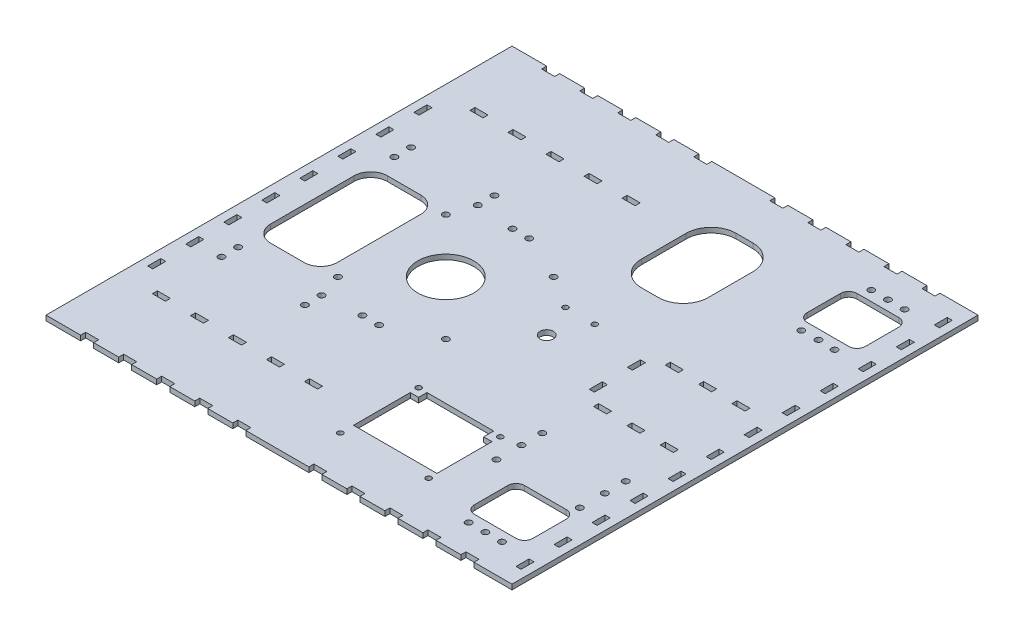
from build123d import *

# Parameters (mm, degrees)
SKETCH1_W               = 279.4
SKETCH1_H               = 279.4
BOSS_EXTRUDE1_DEPTH     = 3
SKETCH3_W               = 3
SKETCH3_H               = 7.8
CUT_EXTRUDE2_DEPTH      = 198.588410591
LPATTERN1_COUNT         = 12
LPATTERN1_PITCH         = 22.8
SKETCH5_W               = 7.8
SKETCH5_H               = 3
CUT_EXTRUDE3_DEPTH      = 198.588410591
LPATTERN2_COUNT         = 11
LPATTERN2_PITCH         = 22.8
MIRROR2_COPY_1_SKETCH_W = 7.8
MIRROR2_COPY_1_SKETCH_H = 3
MIRROR2_COPY_1_DEPTH    = 198.588410591
MIRROR2_COPY_2_SKETCH_W = 7.8
MIRROR2_COPY_2_SKETCH_H = 3
MIRROR2_COPY_2_DEPTH    = 198.588410591
MIRROR2_COPY_3_SKETCH_W = 7.8
MIRROR2_COPY_3_SKETCH_H = 3
MIRROR2_COPY_3_DEPTH    = 198.588410591
MIRROR2_COPY_4_SKETCH_W = 7.8
MIRROR2_COPY_4_SKETCH_H = 3
MIRROR2_COPY_4_DEPTH    = 198.588410591
MIRROR2_COPY_5_SKETCH_W = 7.8
MIRROR2_COPY_5_SKETCH_H = 3
MIRROR2_COPY_5_DEPTH    = 198.588410591
MIRROR2_COPY_6_SKETCH_W = 7.8
MIRROR2_COPY_6_SKETCH_H = 3
MIRROR2_COPY_6_DEPTH    = 198.588410591
MIRROR2_COPY_7_SKETCH_W = 7.8
MIRROR2_COPY_7_SKETCH_H = 3
MIRROR2_COPY_7_DEPTH    = 198.588410591
MIRROR2_COPY_8_SKETCH_W = 7.8
MIRROR2_COPY_8_SKETCH_H = 3
MIRROR2_COPY_8_DEPTH    = 198.588410591
MIRROR2_COPY_9_SKETCH_W = 7.8
MIRROR2_COPY_9_SKETCH_H = 3
MIRROR2_COPY_9_DEPTH    = 198.588410591
SKETCH6_W               = 3
SKETCH6_H               = 7.8
CUT_EXTRUDE4_DEPTH      = 198.588410591
LPATTERN3_COUNT         = 8
LPATTERN3_PITCH         = 22.8
SKETCH7_R               = 16.75
CUT_EXTRUDE5_DEPTH      = 198.588410591
F_6_CLEARANCE_HOLE1_D   = 3.7973
F_6_CLEARANCE_HOLE2_D   = 3.7973
SKETCH14_R              = 4
CUT_EXTRUDE6_DEPTH      = 198.588410591
SKETCH16_W              = 7.8
SKETCH16_H              = 3
CUT_EXTRUDE8_DEPTH      = 198.588410591
LPATTERN5_COUNT         = 5
LPATTERN5_PITCH         = 22.8
MIRROR4_COPY_1_SKETCH_W = 7.8
MIRROR4_COPY_1_SKETCH_H = 3
MIRROR4_COPY_1_DEPTH    = 198.588410591
MIRROR4_COPY_2_SKETCH_W = 7.8
MIRROR4_COPY_2_SKETCH_H = 3
MIRROR4_COPY_2_DEPTH    = 198.588410591
MIRROR4_COPY_3_SKETCH_W = 7.8
MIRROR4_COPY_3_SKETCH_H = 3
MIRROR4_COPY_3_DEPTH    = 198.588410591
MIRROR4_COPY_4_SKETCH_W = 7.8
MIRROR4_COPY_4_SKETCH_H = 3
MIRROR4_COPY_4_DEPTH    = 198.588410591
SKETCH17_W              = 7.8
SKETCH17_H              = 3
CUT_EXTRUDE9_DEPTH      = 198.588410591
LPATTERN6_COUNT         = 3
LPATTERN6_PITCH         = 20
SKETCH18_W              = 3
SKETCH18_H              = 7.8
CUT_EXTRUDE10_DEPTH     = 198.588410591
MIRROR5_COPY_1_SKETCH_W = 7.8
MIRROR5_COPY_1_SKETCH_H = 3
MIRROR5_COPY_1_DEPTH    = 198.588410591
MIRROR5_COPY_2_SKETCH_W = 7.8
MIRROR5_COPY_2_SKETCH_H = 3
MIRROR5_COPY_2_DEPTH    = 198.588410591
CUT_EXTRUDE11_DEPTH     = 198.588410591
F_4_CLEARANCE_HOLE1_D   = 3.2639
CUT_EXTRUDE12_REACH     = 199.588
F_6_CLEARANCE_HOLE3_D   = 3.7973
F_4_CLEARANCE_HOLE2_D   = 3.2639


with BuildPart() as part:
    # Sketch1 → Boss-Extrude1 (new body)
    with BuildSketch(Plane(origin=(0, 0, 0), x_dir=(1, 0, 0), z_dir=(0, 1, 0))):
        Rectangle(SKETCH1_W, SKETCH1_H)
    extrude(amount=BOSS_EXTRUDE1_DEPTH)

    # Sketch3 → Cut-Extrude2 (cut, through all)
    with BuildSketch(Plane(origin=(0, 0, 0), x_dir=(-1, 0, 0), z_dir=(0, -1, 0))):
        with Locations((-133.2, 125.4)):
            Rectangle(SKETCH3_W, SKETCH3_H)
    cut_extrude2 = extrude(amount=-CUT_EXTRUDE2_DEPTH, mode=Mode.SUBTRACT)

    # LPattern1: Cut-Extrude2 ×12
    with Locations(*[(0, 0, i * LPATTERN1_PITCH) for i in range(1, LPATTERN1_COUNT)]):
        add(cut_extrude2, mode=Mode.SUBTRACT)

    # Sketch5 → Cut-Extrude3 (cut, through all)
    with BuildSketch(Plane.XZ):
        with Locations((113, -138.2)):
            Rectangle(SKETCH5_W, SKETCH5_H)
    cut_extrude3 = extrude(amount=-CUT_EXTRUDE3_DEPTH, mode=Mode.SUBTRACT)

    # LPattern2: Cut-Extrude3 ×11, 1 skipped
    with Locations(*[(-i * LPATTERN2_PITCH, 0, 0) for i in range(1, LPATTERN2_COUNT) if i not in (5,)]):
        add(cut_extrude3, mode=Mode.SUBTRACT)

    # Mirror2: Cut-Extrude3 across plane
    add(cut_extrude3.mirror(Plane.XY), mode=Mode.SUBTRACT)

    # Mirror2 copy 1 sketch → Mirror2 copy 1 (cut, through all)
    with BuildSketch(Plane(origin=(-22.8, 0, 0), x_dir=(1, 0, 0), z_dir=(0, -1, 0))):
        with Locations((113, 138.2)):
            Rectangle(MIRROR2_COPY_1_SKETCH_W, MIRROR2_COPY_1_SKETCH_H)
    extrude(amount=-MIRROR2_COPY_1_DEPTH, mode=Mode.SUBTRACT)

    # Mirror2 copy 2 sketch → Mirror2 copy 2 (cut, through all)
    with BuildSketch(Plane(origin=(-45.6, 0, 0), x_dir=(1, 0, 0), z_dir=(0, -1, 0))):
        with Locations((113, 138.2)):
            Rectangle(MIRROR2_COPY_2_SKETCH_W, MIRROR2_COPY_2_SKETCH_H)
    extrude(amount=-MIRROR2_COPY_2_DEPTH, mode=Mode.SUBTRACT)

    # Mirror2 copy 3 sketch → Mirror2 copy 3 (cut, through all)
    with BuildSketch(Plane(origin=(-68.4, 0, 0), x_dir=(1, 0, 0), z_dir=(0, -1, 0))):
        with Locations((113, 138.2)):
            Rectangle(MIRROR2_COPY_3_SKETCH_W, MIRROR2_COPY_3_SKETCH_H)
    extrude(amount=-MIRROR2_COPY_3_DEPTH, mode=Mode.SUBTRACT)

    # Mirror2 copy 4 sketch → Mirror2 copy 4 (cut, through all)
    with BuildSketch(Plane(origin=(-91.2, 0, 0), x_dir=(1, 0, 0), z_dir=(0, -1, 0))):
        with Locations((113, 138.2)):
            Rectangle(MIRROR2_COPY_4_SKETCH_W, MIRROR2_COPY_4_SKETCH_H)
    extrude(amount=-MIRROR2_COPY_4_DEPTH, mode=Mode.SUBTRACT)

    # Mirror2 copy 5 sketch → Mirror2 copy 5 (cut, through all)
    with BuildSketch(Plane(origin=(-136.8, 0, 0), x_dir=(1, 0, 0), z_dir=(0, -1, 0))):
        with Locations((113, 138.2)):
            Rectangle(MIRROR2_COPY_5_SKETCH_W, MIRROR2_COPY_5_SKETCH_H)
    extrude(amount=-MIRROR2_COPY_5_DEPTH, mode=Mode.SUBTRACT)

    # Mirror2 copy 6 sketch → Mirror2 copy 6 (cut, through all)
    with BuildSketch(Plane(origin=(-159.6, 0, 0), x_dir=(1, 0, 0), z_dir=(0, -1, 0))):
        with Locations((113, 138.2)):
            Rectangle(MIRROR2_COPY_6_SKETCH_W, MIRROR2_COPY_6_SKETCH_H)
    extrude(amount=-MIRROR2_COPY_6_DEPTH, mode=Mode.SUBTRACT)

    # Mirror2 copy 7 sketch → Mirror2 copy 7 (cut, through all)
    with BuildSketch(Plane(origin=(-182.4, 0, 0), x_dir=(1, 0, 0), z_dir=(0, -1, 0))):
        with Locations((113, 138.2)):
            Rectangle(MIRROR2_COPY_7_SKETCH_W, MIRROR2_COPY_7_SKETCH_H)
    extrude(amount=-MIRROR2_COPY_7_DEPTH, mode=Mode.SUBTRACT)

    # Mirror2 copy 8 sketch → Mirror2 copy 8 (cut, through all)
    with BuildSketch(Plane(origin=(-205.2, 0, 0), x_dir=(1, 0, 0), z_dir=(0, -1, 0))):
        with Locations((113, 138.2)):
            Rectangle(MIRROR2_COPY_8_SKETCH_W, MIRROR2_COPY_8_SKETCH_H)
    extrude(amount=-MIRROR2_COPY_8_DEPTH, mode=Mode.SUBTRACT)

    # Mirror2 copy 9 sketch → Mirror2 copy 9 (cut, through all)
    with BuildSketch(Plane(origin=(-228, 0, 0), x_dir=(1, 0, 0), z_dir=(0, -1, 0))):
        with Locations((113, 138.2)):
            Rectangle(MIRROR2_COPY_9_SKETCH_W, MIRROR2_COPY_9_SKETCH_H)
    extrude(amount=-MIRROR2_COPY_9_DEPTH, mode=Mode.SUBTRACT)

    # Sketch6 → Cut-Extrude4 (cut, through all)
    with BuildSketch(Plane.XZ):
        with Locations((-133.2, -79.8)):
            Rectangle(SKETCH6_W, SKETCH6_H)
    cut_extrude4 = extrude(amount=-CUT_EXTRUDE4_DEPTH, mode=Mode.SUBTRACT)

    # LPattern3: Cut-Extrude4 ×8
    with Locations(*[(0, 0, i * LPATTERN3_PITCH) for i in range(1, LPATTERN3_COUNT)]):
        add(cut_extrude4, mode=Mode.SUBTRACT)

    # Sketch7 → Cut-Extrude5 (cut, through all)
    with BuildSketch(Plane(origin=(0, 0, 0), x_dir=(-1, 0, 0), z_dir=(0, -1, 0))):
        with Locations(Location((39.7, 0, 0), (0, 0, 90))):
            Circle(SKETCH7_R)
    extrude(amount=-CUT_EXTRUDE5_DEPTH, mode=Mode.SUBTRACT)

    # #6 Clearance Hole1 (through all)
    with Locations(Plane(origin=(0, 3, 0), x_dir=(1, 0, 0), z_dir=(0, 1, 0))):
        with Locations((-72.025, -32.325), (-72.025, 32.325), (-7.375, 32.325), (-7.375, -32.325)):
            Hole(F_6_CLEARANCE_HOLE1_D / 2)

    # #6 Clearance Hole2 (through all)
    with Locations(Plane(origin=(0, 3, 0), x_dir=(1, 0, 0), z_dir=(0, 1, 0))):
        with Locations((-117.36, 56.83), (-67.36, 56.83), (-117.36, -56.83), (-67.36, -56.83), (-67.36, -46.83), (-117.36, -46.83), (-67.36, 46.83), (-117.36, 46.83)):
            Hole(F_6_CLEARANCE_HOLE2_D / 2)

    # Sketch14 → Cut-Extrude6 (cut, through all)
    with BuildSketch(Plane(origin=(0, 0, 0), x_dir=(-1, 0, 0), z_dir=(0, -1, 0))):
        with Locations(Location((-20.8, 0, 0), (0, 0, 90))):
            Circle(SKETCH14_R)
    extrude(amount=-CUT_EXTRUDE6_DEPTH, mode=Mode.SUBTRACT)

    # Sketch16 → Cut-Extrude8 (cut, through all)
    with BuildSketch(Plane.XZ):
        with Locations((-115, 95.2)):
            Rectangle(SKETCH16_W, SKETCH16_H)
    cut_extrude8 = extrude(amount=-CUT_EXTRUDE8_DEPTH, mode=Mode.SUBTRACT)

    # LPattern5: Cut-Extrude8 ×5
    with Locations(*[(i * LPATTERN5_PITCH, 0, 0) for i in range(1, LPATTERN5_COUNT)]):
        add(cut_extrude8, mode=Mode.SUBTRACT)

    # Mirror4: Cut-Extrude8 across plane
    add(cut_extrude8.mirror(Plane.XY), mode=Mode.SUBTRACT)

    # Mirror4 copy 1 sketch → Mirror4 copy 1 (cut, through all)
    with BuildSketch(Plane(origin=(22.8, 0, 0), x_dir=(1, 0, 0), z_dir=(0, -1, 0))):
        with Locations((-115, -95.2)):
            Rectangle(MIRROR4_COPY_1_SKETCH_W, MIRROR4_COPY_1_SKETCH_H)
    extrude(amount=-MIRROR4_COPY_1_DEPTH, mode=Mode.SUBTRACT)

    # Mirror4 copy 2 sketch → Mirror4 copy 2 (cut, through all)
    with BuildSketch(Plane(origin=(45.6, 0, 0), x_dir=(1, 0, 0), z_dir=(0, -1, 0))):
        with Locations((-115, -95.2)):
            Rectangle(MIRROR4_COPY_2_SKETCH_W, MIRROR4_COPY_2_SKETCH_H)
    extrude(amount=-MIRROR4_COPY_2_DEPTH, mode=Mode.SUBTRACT)

    # Mirror4 copy 3 sketch → Mirror4 copy 3 (cut, through all)
    with BuildSketch(Plane(origin=(68.4, 0, 0), x_dir=(1, 0, 0), z_dir=(0, -1, 0))):
        with Locations((-115, -95.2)):
            Rectangle(MIRROR4_COPY_3_SKETCH_W, MIRROR4_COPY_3_SKETCH_H)
    extrude(amount=-MIRROR4_COPY_3_DEPTH, mode=Mode.SUBTRACT)

    # Mirror4 copy 4 sketch → Mirror4 copy 4 (cut, through all)
    with BuildSketch(Plane(origin=(91.2, 0, 0), x_dir=(1, 0, 0), z_dir=(0, -1, 0))):
        with Locations((-115, -95.2)):
            Rectangle(MIRROR4_COPY_4_SKETCH_W, MIRROR4_COPY_4_SKETCH_H)
    extrude(amount=-MIRROR4_COPY_4_DEPTH, mode=Mode.SUBTRACT)

    # Sketch17 → Cut-Extrude9 (cut, through all)
    with BuildSketch(Plane.XZ):
        with Locations((115.8, 21.5)):
            Rectangle(SKETCH17_W, SKETCH17_H)
    cut_extrude9 = extrude(amount=-CUT_EXTRUDE9_DEPTH, mode=Mode.SUBTRACT)

    # LPattern6: Cut-Extrude9 ×3
    with Locations(*[(-i * LPATTERN6_PITCH, 0, 0) for i in range(1, LPATTERN6_COUNT)]):
        add(cut_extrude9, mode=Mode.SUBTRACT)

    # Sketch18 → Cut-Extrude10 (cut, through all)
    with BuildSketch(Plane(origin=(0, 0, 0), x_dir=(-1, 0, 0), z_dir=(0, -1, 0))):
        with Locations((-63.2, -11.4)):
            Rectangle(SKETCH18_W, SKETCH18_H)
    cut_extrude10 = extrude(amount=-CUT_EXTRUDE10_DEPTH, mode=Mode.SUBTRACT)

    # Mirror5: Cut-Extrude9, Cut-Extrude10 across plane
    add(cut_extrude9.mirror(Plane.XY), mode=Mode.SUBTRACT)
    add(cut_extrude10.mirror(Plane.XY), mode=Mode.SUBTRACT)

    # Mirror5 copy 1 sketch → Mirror5 copy 1 (cut, through all)
    with BuildSketch(Plane(origin=(-20, 0, 0), x_dir=(1, 0, 0), z_dir=(0, -1, 0))):
        with Locations((115.8, -21.5)):
            Rectangle(MIRROR5_COPY_1_SKETCH_W, MIRROR5_COPY_1_SKETCH_H)
    extrude(amount=-MIRROR5_COPY_1_DEPTH, mode=Mode.SUBTRACT)

    # Mirror5 copy 2 sketch → Mirror5 copy 2 (cut, through all)
    with BuildSketch(Plane(origin=(-40, 0, 0), x_dir=(1, 0, 0), z_dir=(0, -1, 0))):
        with Locations((115.8, -21.5)):
            Rectangle(MIRROR5_COPY_2_SKETCH_W, MIRROR5_COPY_2_SKETCH_H)
    extrude(amount=-MIRROR5_COPY_2_DEPTH, mode=Mode.SUBTRACT)

    # Sketch19 → Cut-Extrude11 (cut, through all)
    with BuildSketch(Plane.XZ):
        with BuildLine():
            Line((24.7, -109.7), (34.7, -109.7))
            ThreePointArc((34.7, -109.7), (45.306601718, -105.306601718), (49.7, -94.7))
            Line((49.7, -94.7), (49.7, -68))
            ThreePointArc((49.7, -68), (45.306601718, -57.393398282), (34.7, -53))
            Line((34.7, -53), (24.7, -53))
            ThreePointArc((24.7, -53), (14.093398282, -57.393398282), (9.7, -68))
            Line((9.7, -68), (9.7, -94.7))
            ThreePointArc((9.7, -94.7), (14.093398282, -105.306601718), (24.7, -109.7))
        make_face()
        with BuildLine():
            Line((-89.7, 35), (-109.7, 35))
            ThreePointArc((-109.7, 35), (-116.771067812, 32.071067812), (-119.7, 25))
            Line((-119.7, 25), (-119.7, -25))
            ThreePointArc((-119.7, -25), (-116.771067812, -32.071067812), (-109.7, -35))
            Line((-109.7, -35), (-89.7, -35))
            ThreePointArc((-89.7, -35), (-82.628932188, -32.071067812), (-79.7, -25))
            Line((-79.7, -25), (-79.7, 25))
            ThreePointArc((-79.7, 25), (-82.628932188, 32.071067812), (-89.7, 35))
        make_face()
        Polygon((9.7, 104.7), (59.7, 104.7), (59.7, 71.7), (54.7, 71.7), (54.7, 65.7), (14.7, 65.7), (14.7, 70.7), (9.7, 70.7), align=None)
    extrude(amount=-CUT_EXTRUDE11_DEPTH, mode=Mode.SUBTRACT)

    # #4 Clearance Hole1 (through all)
    with Locations(Plane(origin=(0, 3, 0), x_dir=(1, 0, 0), z_dir=(0, 1, 0))):
        with Locations((9.7, -65.7), (59.7, -66.7), (59.7, -109.7), (9.7, -112.7)):
            Hole(F_4_CLEARANCE_HOLE1_D / 2)

    # Sketch22 → Cut-Extrude12 (cut, up to next)
    with BuildSketch(Plane(origin=(0, 3, 0), x_dir=(1, 0, 0), z_dir=(0, 1, 0)), mode=Mode.PRIVATE) as cut_extrude12_sk1:
        with BuildLine():
            Line((92.2, -84.7), (117.2, -84.7))
            ThreePointArc((117.2, -84.7), (120.735533906, -86.164466094), (122.2, -89.7))
            Line((122.2, -89.7), (122.2, -109.7))
            ThreePointArc((122.2, -109.7), (120.735533906, -113.235533906), (117.2, -114.7))
            Line((117.2, -114.7), (92.2, -114.7))
            ThreePointArc((92.2, -114.7), (88.664466094, -113.235533906), (87.2, -109.7))
            Line((87.2, -109.7), (87.2, -89.7))
            ThreePointArc((87.2, -89.7), (88.664466094, -86.164466094), (92.2, -84.7))
        make_face()
    cut_extrude12_tool1 = extrude(cut_extrude12_sk1.sketch, amount=-CUT_EXTRUDE12_REACH, mode=Mode.PRIVATE) & part.part
    # Sketch22 → Cut-Extrude12 (cut, up to next)
    with BuildSketch(Plane(origin=(0, 3, 0), x_dir=(1, 0, 0), z_dir=(0, 1, 0)), mode=Mode.PRIVATE) as cut_extrude12_sk2:
        with BuildLine():
            Line((92.2, 114.7), (117.2, 114.7))
            ThreePointArc((117.2, 114.7), (120.735533906, 113.235533906), (122.2, 109.7))
            Line((122.2, 109.7), (122.2, 89.7))
            ThreePointArc((122.2, 89.7), (120.735533906, 86.164466094), (117.2, 84.7))
            Line((117.2, 84.7), (92.2, 84.7))
            ThreePointArc((92.2, 84.7), (88.664466094, 86.164466094), (87.2, 89.7))
            Line((87.2, 89.7), (87.2, 109.7))
            ThreePointArc((87.2, 109.7), (88.664466094, 113.235533906), (92.2, 114.7))
        make_face()
    cut_extrude12_tool2 = extrude(cut_extrude12_sk2.sketch, amount=-CUT_EXTRUDE12_REACH, mode=Mode.PRIVATE) & part.part
    add(cut_extrude12_tool1.solids().sort_by_distance((104.7, 3, 99.7))[0], mode=Mode.SUBTRACT)
    add(cut_extrude12_tool2.solids().sort_by_distance((104.7, 3, -99.7))[0], mode=Mode.SUBTRACT)

    # #6 Clearance Hole3 (through all)
    with Locations(Plane(origin=(0, 3, 0), x_dir=(1, 0, 0), z_dir=(0, 1, 0))):
        with Locations((94.7, 120.7), (114.7, 120.7), (114.7, 78.7), (94.7, 78.7), (104.7, 79.030891432), (104.7, 120.7), (70.35, -52.2), (70.35, -79.7), (70.35, -64.7), (120.35, -64.7), (120.35, -52.2), (120.35, -79.7), (161.748665947, 56.976330935), (114.7, -120.7), (104.7, -120.7), (94.7, -120.7), (-44.7, 45), (-34.7, 45), (-44.7, -45), (-34.7, -45)):
            Hole(F_6_CLEARANCE_HOLE3_D / 2)

    # #4 Clearance Hole2 (through all)
    with Locations(Plane(origin=(0, 3, 0), x_dir=(1, 0, 0), z_dir=(0, 1, 0))):
        with Locations((12.05, 20), (29.55, 20)):
            Hole(F_4_CLEARANCE_HOLE2_D / 2)


solid = part.part
